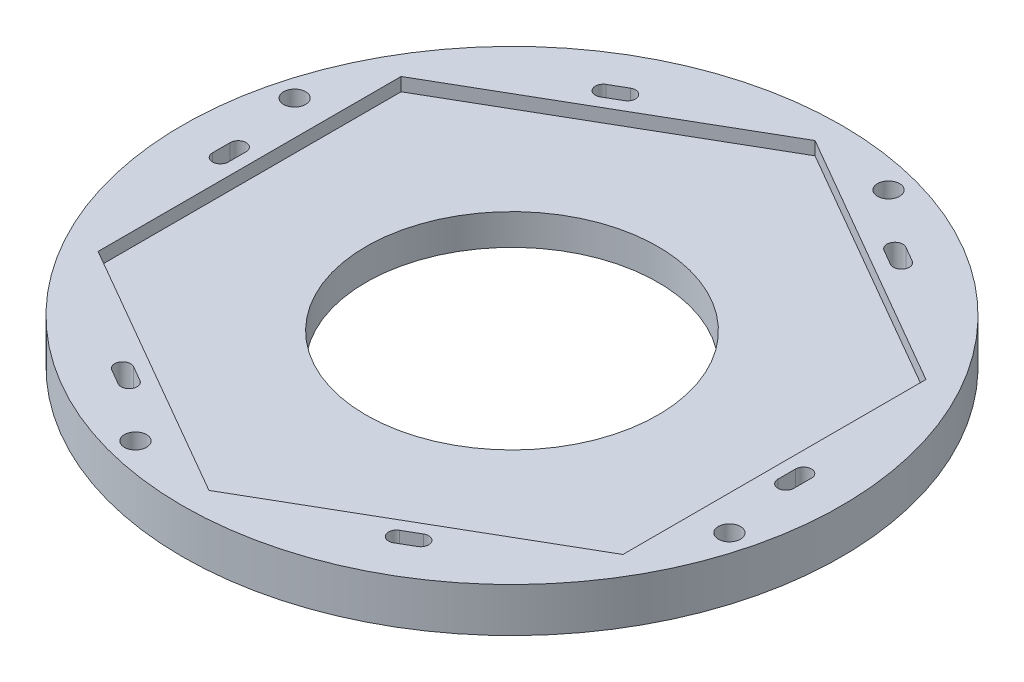
from build123d import *

# Parameters (mm, degrees)
CROQUIS1_R                                     = 74.5
CROQUIS1_R_2                                   = 33
SALIENTE_EXTRUIR1_DEPTH                        = 7
CROQUIS2_R                                     = 74.5
SALIENTE_EXTRUIR2_DEPTH                        = 3
CROQUIS4_R                                     = 2.5
CORTAR_EXTRUIR2_DEPTH                          = 106.832414694
CSK_START                                      = -1
CSK_SLOT_FOR_M3_FLAT_HEAD_MACHINE_SCREW2_DEPTH = 12
CIRPATTERN1_COUNT                              = 6


with BuildPart() as part:
    # Croquis1 → Saliente-Extruir1 (new body)
    with BuildSketch(Plane(origin=(0, 0, 0), x_dir=(1, 0, 0), z_dir=(0, 1, 0))):
        with Locations(Location((0, 0, 0), (0, 0, 270))):
            Circle(CROQUIS1_R)
        with Locations(Location((0, 0, 0), (0, 0, 270))):
            Circle(CROQUIS1_R_2, mode=Mode.SUBTRACT)
    extrude(amount=SALIENTE_EXTRUIR1_DEPTH)

    # Croquis2 → Saliente-Extruir2 (add)
    with BuildSketch(Plane(origin=(0, 7, 0), x_dir=(1, 0, 0), z_dir=(0, 1, 0))):
        with Locations(Location((0, 0, 0), (0, 0, 270))):
            Circle(CROQUIS2_R)
        Polygon((-59.325, 34.25130472), (-59.325, -34.25130472), (0, -68.502609439), (59.325, -34.25130472), (59.325, 34.25130472), (0, 68.502609439), align=None, mode=Mode.SUBTRACT)
    extrude(amount=SALIENTE_EXTRUIR2_DEPTH)

    # Croquis4 → Cortar-Extruir2 (cut, through all)
    with BuildSketch(Plane(origin=(0, 10, 0), x_dir=(1, 0, 0), z_dir=(0, 1, 0))):
        with Locations(Location((17.987923635, 67.131844927, 0), (0, 0, 270))):
            Circle(CROQUIS4_R)
        with Locations(Location((67.131844927, -17.987923635, 0), (0, 0, 270))):
            Circle(CROQUIS4_R)
        with Locations(Location((-17.987923635, -67.131844927, 0), (0, 0, 270))):
            Circle(CROQUIS4_R)
        with Locations(Location((-67.131844927, 17.987923635, 0), (0, 0, 270))):
            Circle(CROQUIS4_R)
    extrude(amount=-CORTAR_EXTRUIR2_DEPTH, mode=Mode.SUBTRACT)

    # CSK SLOT for M3 Flat Head Machine Screw2: read off the stored shape, not the designer's step
    # CSK SLOT for M3 Flat Head Machine Sc 2 → CSK SLOT for M3 Flat Head Machine Screw2 (cut)
    with BuildSketch(Plane(origin=(0, 0, 0), x_dir=(1, 0, 0), z_dir=(0, 1, 0)).offset(CSK_START)):
        with BuildLine():
            ThreePointArc((-31.110894632, -57.903382972), (-28.652048905, -57.244537245), (-29.310894632, -54.785691518))
            Line((-29.310894632, -54.785691518), (-32.774996247, -52.785691518))
            ThreePointArc((-32.774996247, -52.785691518), (-35.233841974, -53.444537245), (-34.574996247, -55.903382972))
            Line((-34.574996247, -55.903382972), (-31.110894632, -57.903382972))
        make_face()
    csk_slot_for_m3_flat_head_machine_screw2 = extrude(amount=CSK_SLOT_FOR_M3_FLAT_HEAD_MACHINE_SCREW2_DEPTH, mode=Mode.SUBTRACT)

    # CSK SLOT for M3 Flat Head Machine Sc 3: loft between two sections, ruled curve by curve
    csk_slot_for_m3_flat_head_machine_sc_3_from = [
        Edge.make_three_point_arc((-29.310894632, 1.35, 54.785691518), (-28.472228144, 1.35, 55.878662964), (-28.652048905, 1.35, 57.244537245)),
        Edge.make_three_point_arc((-28.652048905, 1.35, 57.244537245), (-29.74502035, 1.35, 58.083203732), (-31.110894632, 1.35, 57.903382972)),
        Edge.make_three_point_arc((-34.574996247, 1.35, 55.903382972), (-35.413662734, 1.35, 54.810411526), (-35.233841974, 1.35, 53.444537245)),
        Edge.make_three_point_arc((-35.233841974, 1.35, 53.444537245), (-34.140870528, 1.35, 52.605870758), (-32.774996247, 1.35, 52.785691518)),
        Edge.make_line((-31.110894632, 1.35, 57.903382972), (-34.574996247, 1.35, 55.903382972)),
        Edge.make_line((-29.310894632, 1.35, 54.785691518), (-32.774996247, 1.35, 52.785691518)),
    ]
    csk_slot_for_m3_flat_head_machine_sc_3_to = [
        Edge.make_three_point_arc((-28.635894632, 0, 53.616557223), (-27.168228279, 0, 55.529257253), (-27.48291461, 0, 57.919537245)),
        Edge.make_three_point_arc((-27.48291461, 0, 57.919537245), (-29.39561464, 0, 59.387203598), (-31.785894632, 0, 59.072517267)),
        Edge.make_three_point_arc((-35.249996247, 0, 57.072517267), (-36.7176626, 0, 55.159817237), (-36.402976269, 0, 52.769537245)),
        Edge.make_three_point_arc((-36.402976269, 0, 52.769537245), (-34.490276239, 0, 51.301870892), (-32.099996247, 0, 51.616557223)),
        Edge.make_line((-31.785894632, 0, 59.072517267), (-35.249996247, 0, 57.072517267)),
        Edge.make_line((-28.635894632, 0, 53.616557223), (-32.099996247, 0, 51.616557223)),
    ]
    csk_slot_for_m3_flat_head_machine_sc_3 = Solid(Shell([*[Face.make_surface_from_curves(csk_slot_for_m3_flat_head_machine_sc_3_from[k], csk_slot_for_m3_flat_head_machine_sc_3_to[k]) for k in range(6)], Face(Wire(csk_slot_for_m3_flat_head_machine_sc_3_from)), Face(Wire(csk_slot_for_m3_flat_head_machine_sc_3_to))]))
    add(csk_slot_for_m3_flat_head_machine_sc_3, mode=Mode.SUBTRACT)

    # CirPattern1: CSK SLOT for M3 Flat Head Machine Screw2, CSK SLOT for M3 Flat Head Machine Sc 3 ×6 about axis
    cirpattern1_axis = Axis((0, 0, 0), (0, 1, 0))
    add([csk_slot_for_m3_flat_head_machine_screw2.rotate(cirpattern1_axis, i * 360 / CIRPATTERN1_COUNT) for i in range(1, CIRPATTERN1_COUNT)], mode=Mode.SUBTRACT)
    add([csk_slot_for_m3_flat_head_machine_sc_3.rotate(cirpattern1_axis, i * 360 / CIRPATTERN1_COUNT) for i in range(1, CIRPATTERN1_COUNT)], mode=Mode.SUBTRACT)


solid = part.part
